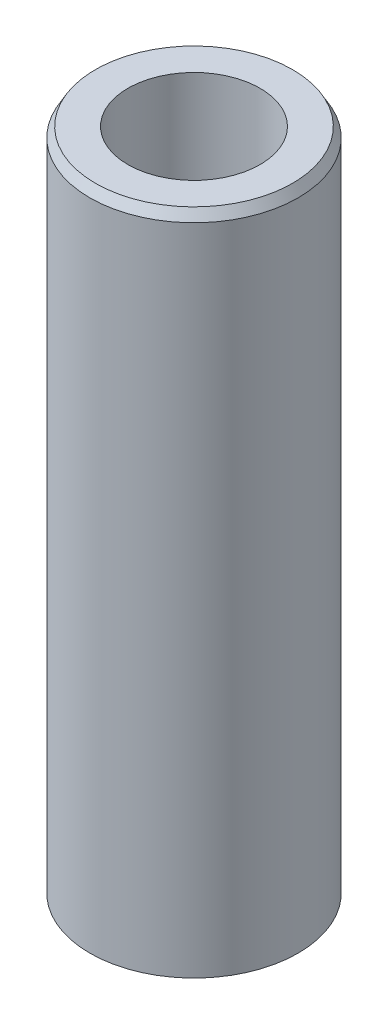
from build123d import *
from OCP.BRepFilletAPI import BRepFilletAPI_MakeChamfer

# Parameters (mm, degrees)
SKETCH1_R           = 47.5
BOSS_EXTRUDE1_DEPTH = 305.404143278
SKETCH2_R           = 30.163001806
CUT_EXTRUDE1_DEPTH  = 313.704638168
CHAMFER1_SIZE       = 4.468065709
CHAMFER1_SIZE2      = 2.550007929


with BuildPart() as part:
    # Sketch1 → Boss-Extrude1 (new body)
    with BuildSketch(Plane(origin=(0, 0, 0), x_dir=(1, 0, 0), z_dir=(0, 1, 0))):
        Circle(SKETCH1_R)
    extrude(amount=BOSS_EXTRUDE1_DEPTH)

    # Sketch2 → Cut-Extrude1 (cut, through all)
    with BuildSketch(Plane(origin=(0, 0, 0), x_dir=(1, 0, 0), z_dir=(0, 1, 0))):
        Circle(SKETCH2_R)
    extrude(amount=CUT_EXTRUDE1_DEPTH, mode=Mode.SUBTRACT)

    # Chamfer1: one chamfer whose edges measure the first distance from different faces: ONE call of the kernel's chamfer builder (chamfer() names one face for all edges)
    chamfer1_edges_1 = [part.edges().sort_by_distance(p)[0] for p in [
        (-47.5, 305.404143278, 0),
    ]]
    chamfer1_side_1 = [part.faces().sort_by_distance(p)[0] for p in [
        (-47.5, 152.702071639, 0),
    ]]
    chamfer1_edges_2 = [part.edges().sort_by_distance(p)[0] for p in [
        (-47.5, 0, 0),
    ]]
    chamfer1_side_2 = [part.faces().sort_by_distance(p)[0] for p in [
        (-46.156497116, 0, 0),
    ]]
    chamfer1 = BRepFilletAPI_MakeChamfer(part.part.solid().wrapped)
    for e in chamfer1_edges_1:
        chamfer1.Add(CHAMFER1_SIZE, CHAMFER1_SIZE2, e.wrapped, chamfer1_side_1[0].wrapped)  # the first distance lies on this face
    for e in chamfer1_edges_2:
        chamfer1.Add(CHAMFER1_SIZE, CHAMFER1_SIZE2, e.wrapped, chamfer1_side_2[0].wrapped)  # the first distance lies on this face
    add(Compound.cast(chamfer1.Shape()), mode=Mode.REPLACE)


solid = part.part
